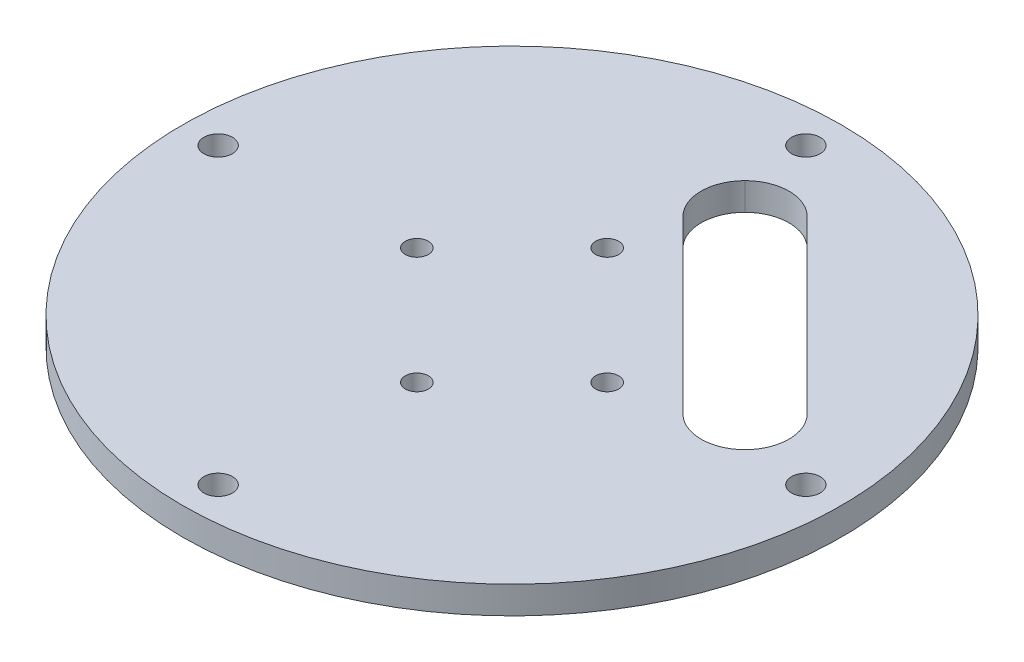
from build123d import *

# Parameters (mm, degrees)
SKETCH_1_R      = 60
SKETCH_1_R_2    = 2.6
SKETCH_1_R_3    = 2.1
EXTRUDE_1_DEPTH = 5
FILLET_1_R      = 8


with BuildPart() as part:
    # 草图1 → 凸台-拉伸1 (new body)
    with BuildSketch(Plane(origin=(0, 0, 0), x_dir=(1, 0, 0), z_dir=(0, 1, 0))):
        with Locations(Location((0, 0, 0), (0, 0, 270))):
            Circle(SKETCH_1_R)
        with Locations(Location((0, 53.5, 0), (0, 0, 270))):
            Circle(SKETCH_1_R_2, mode=Mode.SUBTRACT)
        with Locations(Location((53.5, 0, 0), (0, 0, 90))):
            Circle(SKETCH_1_R_2, mode=Mode.SUBTRACT)
        with Locations(Location((0, -53.5, 0), (0, 0, 90))):
            Circle(SKETCH_1_R_2, mode=Mode.SUBTRACT)
        with Locations(Location((-53.5, 0, 0), (0, 0, 270))):
            Circle(SKETCH_1_R_2, mode=Mode.SUBTRACT)
        with Locations(Location((-1.944543648, 19.268659787, 0), (0, 0, 270))):
            Circle(SKETCH_1_R_3, mode=Mode.SUBTRACT)
        with Locations(Location((19.268659787, -1.944543648, 0), (0, 0, 90))):
            Circle(SKETCH_1_R_3, mode=Mode.SUBTRACT)
        with Locations(Location((1.944543648, -19.268659787, 0), (0, 0, 270))):
            Circle(SKETCH_1_R_3, mode=Mode.SUBTRACT)
        with Locations(Location((-19.268659787, 1.944543648, 0), (0, 0, 90))):
            Circle(SKETCH_1_R_3, mode=Mode.SUBTRACT)
        Polygon((-5.656854249, 36.769552622), (36.769552622, -5.656854249), (48.083261121, 5.656854249), (5.656854249, 48.083261121), align=None, mode=Mode.SUBTRACT)
    extrude(amount=EXTRUDE_1_DEPTH)

    # 圆角1
    fillet_1_edges = [part.edges().sort_by_distance(p)[0] for p in [
        (36.769552622, 2.5, 5.656854249),
        (48.083261121, 2.5, -5.656854249),
        (5.656854249, 2.5, -48.083261121),
        (-5.656854249, 2.5, -36.769552622),
    ]]
    fillet(fillet_1_edges, radius=FILLET_1_R - 0.0001)  # a hair under: the kernel refuses the full size


solid = part.part
